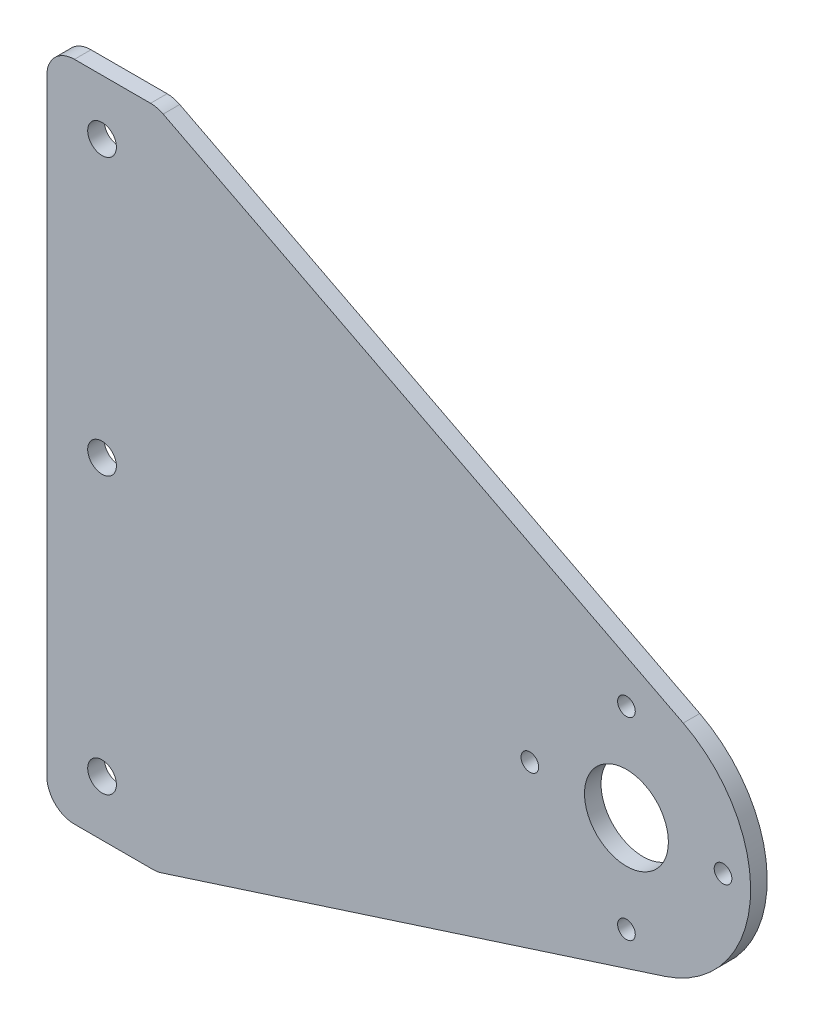
from build123d import *

# Parameters (mm, degrees)
SKETCH_2_R      = 7.6
SKETCH_2_R_2    = 1.6
SKETCH_2_R_3    = 2.6
EXTRUDE_1_DEPTH = 3
FILLET_3_R      = 5


with BuildPart() as part:
    # ｽｹｯﾁ2 → ﾎﾞｽ - 押し出し1 (new body)
    with BuildSketch(Plane.XY):
        with BuildLine():
            Line((-105, 69), (-105, -51))
            Line((-105, -51), (-85, -51))
            Line((-85, -51), (6.894675656, -21.417596681))
            ThreePointArc((6.894675656, -21.417596681), (22.424910395, -1.836680101), (10.287767529, 20.010293333))
            Line((10.287767529, 20.010293333), (-85, 69))
            Line((-85, 69), (-105, 69))
        make_face()
        Circle(SKETCH_2_R, mode=Mode.SUBTRACT)
        with Locations((0, 17.5)):
            Circle(SKETCH_2_R_2, mode=Mode.SUBTRACT)
        with Locations((17.5, 0)):
            Circle(SKETCH_2_R_2, mode=Mode.SUBTRACT)
        with Locations((0, -17.5)):
            Circle(SKETCH_2_R_2, mode=Mode.SUBTRACT)
        with Locations((-17.5, 0)):
            Circle(SKETCH_2_R_2, mode=Mode.SUBTRACT)
        with Locations((-95, 9)):
            Circle(SKETCH_2_R_3, mode=Mode.SUBTRACT)
        with Locations((-95, 59)):
            Circle(SKETCH_2_R_3, mode=Mode.SUBTRACT)
        with Locations((-95, -41)):
            Circle(SKETCH_2_R_3, mode=Mode.SUBTRACT)
    extrude(amount=EXTRUDE_1_DEPTH)

    # ﾌｨﾚｯﾄ3
    fillet_3_edges = [part.edges().sort_by_distance(p)[0] for p in [
        (-85, 69, 1.5),
        (-85, -51, 1.5),
        (-105, -51, 1.5),
        (-105, 69, 1.5),
    ]]
    fillet(fillet_3_edges, radius=FILLET_3_R)


solid = part.part
